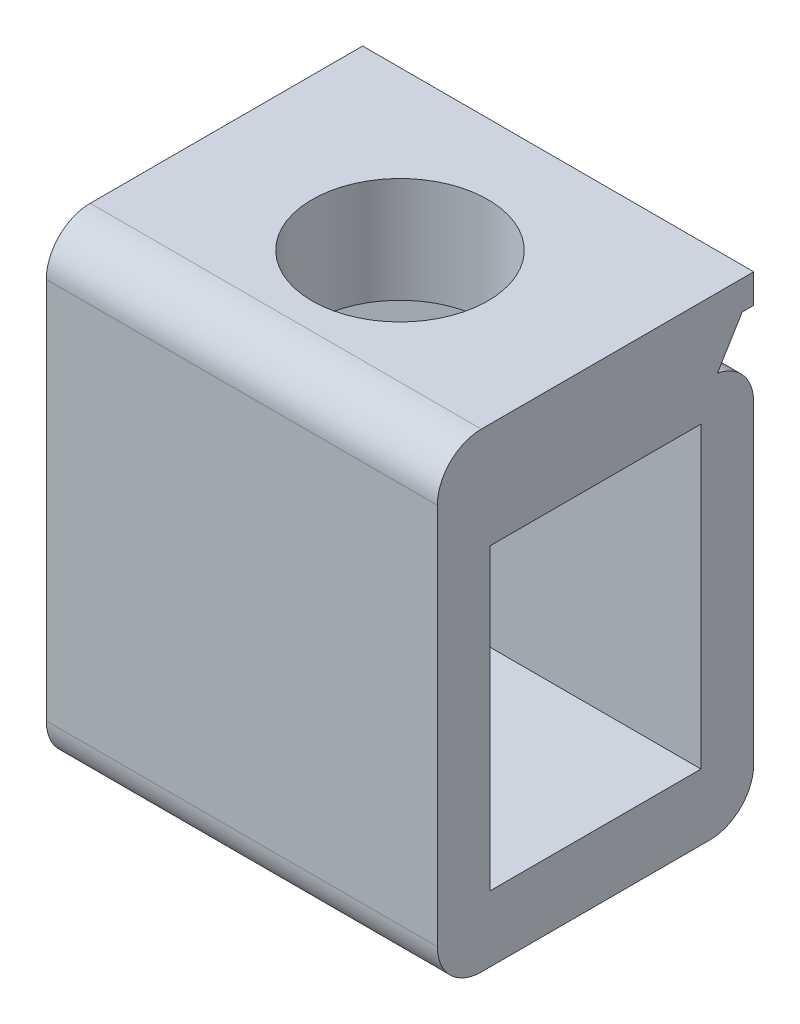
from build123d import *

# Parameters (mm, degrees)
EXTRUDE_1_DEPTH      = 4.45
EXTRUDE_1_DEPTH_BACK = 4.45
SKETCH_1_W           = 7.2
SKETCH_1_H           = 10.7
SKETCH_1_W_2         = 4.8
SKETCH_1_H_2         = 6.8
SKETCH_2_R           = 2
CUT_EXTRUDE_1_DEPTH  = 5
CUT_EXTRUDE_2_DEPTH  = 8.9
FILLET_1_R           = 1


with BuildPart() as part:
    # 草图1 → 凸台-拉伸1 (new, two sides: drawn at the far end of the back side and taken through both)
    with BuildSketch(Plane(origin=(0, 0, 0), x_dir=(0, 0, -1), z_dir=(1, 0, 0)).offset(-EXTRUDE_1_DEPTH_BACK)):
        Rectangle(SKETCH_1_W, SKETCH_1_H)
        with Locations((0, -0.45)):
            Rectangle(SKETCH_1_W_2, SKETCH_1_H_2, mode=Mode.SUBTRACT)
    extrude(amount=EXTRUDE_1_DEPTH + EXTRUDE_1_DEPTH_BACK)

    # 草图2 → 切除-拉伸1 (cut)
    with BuildSketch(Plane(origin=(0, 5.35, 0), x_dir=(1, 0, 0), z_dir=(0, 1, 0))):
        with Locations(Location((0, 0, 0), (0, 0, 270))):
            Circle(SKETCH_2_R)
    extrude(amount=-CUT_EXTRUDE_1_DEPTH, mode=Mode.SUBTRACT)

    # 草图3 → 切除-拉伸2 (cut)
    with BuildSketch(Plane(origin=(4.45, 0, 0), x_dir=(0, 0, -1), z_dir=(1, 0, 0))):
        Polygon((3.6, 4.688566818), (3.336866457, 4.688566818), (2.775968401, 3.765242325), (3.6, 3.765242325), align=None)
    extrude(amount=-CUT_EXTRUDE_2_DEPTH, mode=Mode.SUBTRACT)

    # 圆角1
    # the kernel refuses this fillet: 1 mm, written as the material it takes off along each edge
    with BuildSketch(Plane(origin=(6.95, -5.35, -3.6), x_dir=(0, 0, 1), z_dir=(-1, 0, 0))) as fillet_1_piece_1:
        with BuildLine():
            CenterArc((FILLET_1_R, FILLET_1_R), FILLET_1_R, 180, 90)
            Line((0, FILLET_1_R), (-FILLET_1_R * 0.02, FILLET_1_R))
            Line((-FILLET_1_R * 0.02, FILLET_1_R), (-FILLET_1_R * 0.02, -FILLET_1_R * 0.02))
            Line((-FILLET_1_R * 0.02, -FILLET_1_R * 0.02), (FILLET_1_R, -FILLET_1_R * 0.02))
            Line((FILLET_1_R, -FILLET_1_R * 0.02), (FILLET_1_R, 0))
        make_face()
    extrude(amount=13.9, mode=Mode.SUBTRACT)
    with BuildSketch(Plane(origin=(-6.95, -5.35, 3.6), x_dir=(0, 1, 0), z_dir=(1, 0, 0)), Plane(origin=(-6.95, 5.35, 3.6), x_dir=(0, 0, -1), z_dir=(1, 0, 0))) as fillet_1_piece_2:
        with BuildLine():
            CenterArc((FILLET_1_R, -FILLET_1_R), FILLET_1_R, 90, 90)
            Line((0, -FILLET_1_R), (-FILLET_1_R * 0.02, -FILLET_1_R))
            Line((-FILLET_1_R * 0.02, -FILLET_1_R), (-FILLET_1_R * 0.02, FILLET_1_R * 0.02))
            Line((-FILLET_1_R * 0.02, FILLET_1_R * 0.02), (FILLET_1_R, FILLET_1_R * 0.02))
            Line((FILLET_1_R, FILLET_1_R * 0.02), (FILLET_1_R, 0))
        make_face()
    extrude(amount=13.9, mode=Mode.SUBTRACT)
    with BuildSketch(Plane(origin=(6.910989539, 3.765242325, -3.6), x_dir=(0, -1, 0), z_dir=(-1, 0, 0))) as fillet_1_piece_3_section:
        with BuildLine():
            CenterArc((0.984395816, 1), FILLET_1_R, 190.135017985, 79.864982015)
            Line((0, 0.824031599), (-0.019687916, 0.820512231))
            ThreePointArc((-0.019687916, 0.820512231), (-0.02, 0.412015799), (-0.02, 0))
            Line((-0.02, 0), (0, -0.02))
            Line((0, -0.02), (0.984395816, -0.02))
            Line((0.984395816, -0.02), (0.984395816, 0))
        make_face()
    fillet_1_piece_3 = extrude(amount=13.821979078, mode=Mode.PRIVATE)
    fillet_1_piece_3 = split(fillet_1_piece_3, bisect_by=Plane(origin=(0, 3.873370959, -2.84165402), z_dir=(0, -0.5191865527287748, -0.8546609406458278)), keep=Keep.TOP, mode=Mode.PRIVATE)
    add(fillet_1_piece_3, mode=Mode.SUBTRACT)


solid = part.part
